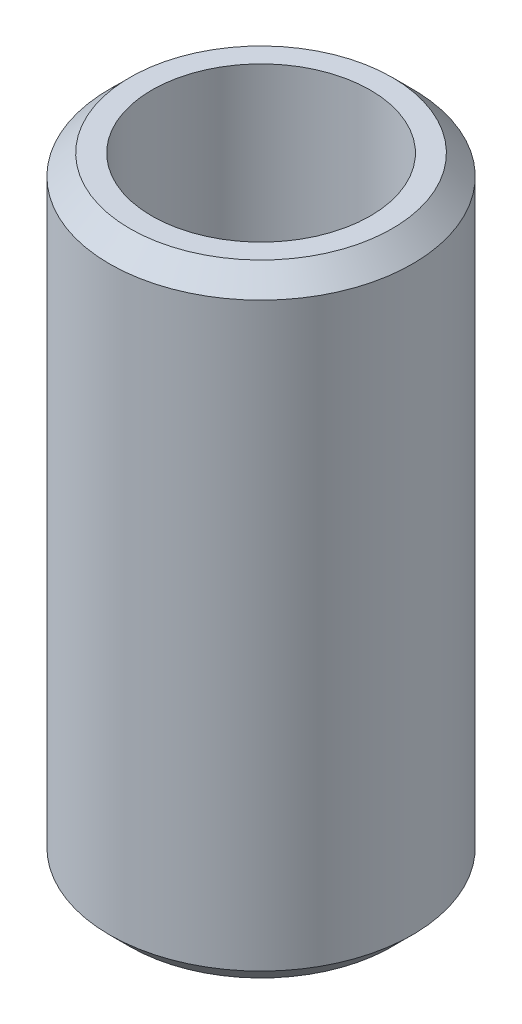
from build123d import *

# Parameters (mm, degrees)
SKETCH1_R           = 37.5
BOSS_EXTRUDE1_DEPTH = 153.952544534
SKETCH2_R           = 27.034371088
CUT_EXTRUDE1_DEPTH  = 163.830850789
CHAMFER1_SIZE       = 5.041917545


with BuildPart() as part:
    # Sketch1 → Boss-Extrude1 (new body)
    with BuildSketch(Plane(origin=(0, 0, 0), x_dir=(1, 0, 0), z_dir=(0, 1, 0))):
        Circle(SKETCH1_R)
    extrude(amount=BOSS_EXTRUDE1_DEPTH)

    # Sketch2 → Cut-Extrude1 (cut, through all)
    with BuildSketch(Plane(origin=(0, 0, 0), x_dir=(1, 0, 0), z_dir=(0, 1, 0))):
        Circle(SKETCH2_R)
    extrude(amount=CUT_EXTRUDE1_DEPTH, mode=Mode.SUBTRACT)

    # Chamfer1
    chamfer1_edges = [part.edges().sort_by_distance(p)[0] for p in [
        (-37.5, 153.952544534, 0),
        (-37.5, 0, 0),
    ]]
    chamfer(chamfer1_edges, length=CHAMFER1_SIZE)


solid = part.part
